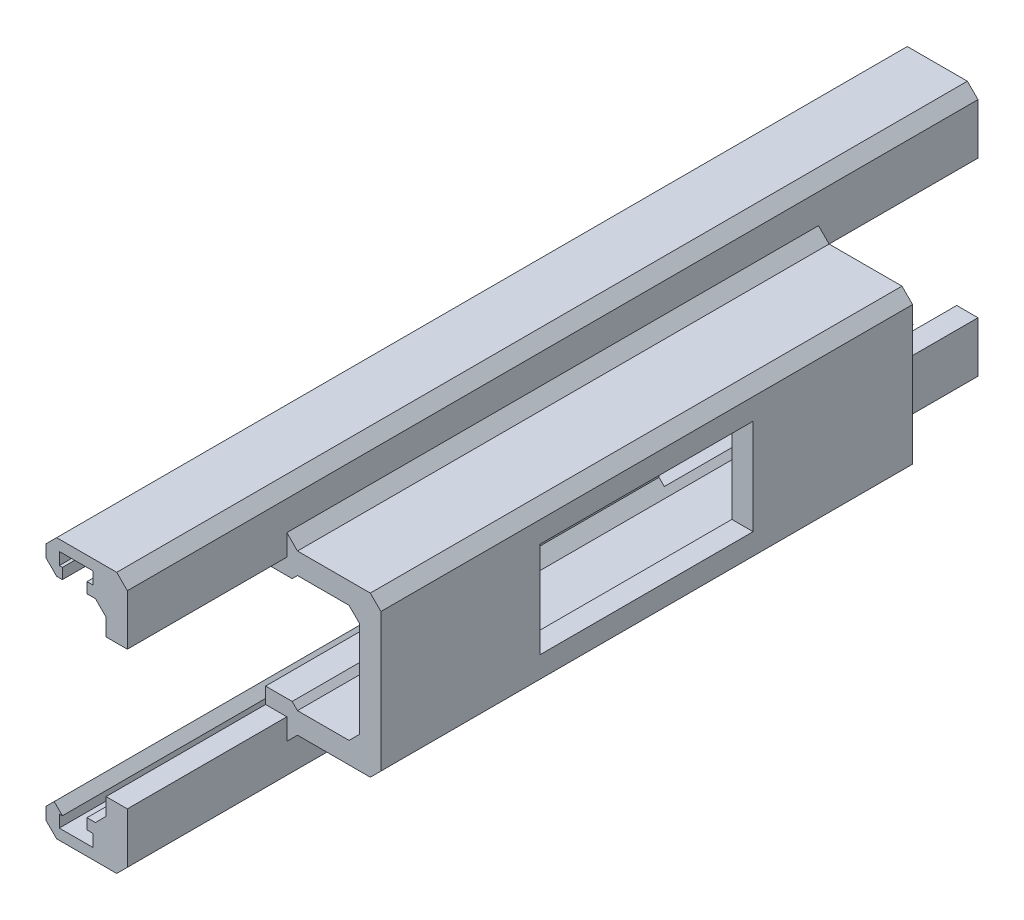
from build123d import *

# Parameters (mm, degrees)
BOSS_EXTRU_1_DEPTH      = 80
BOSS_EXTRU_1_DEPTH_BACK = 80
ESQUISSE4_R             = 1.5
ESQUISSE4_W             = 23
ESQUISSE4_H             = 12.2
ENL_V_MAT_EXTRU_1_DEPTH = 95
ENL_V_START             = -2
ESQUISSE5_W             = 5
ESQUISSE5_H             = 12.2
ESQUISSE5_R             = 1.5
ENL_V_MAT_EXTRU_2_DEPTH = 2
BOSS_EXTRU_3_DEPTH      = 50
BOSS_EXTRU_3_DEPTH_BACK = 50
CHANFREIN2_SIZE         = 2
ESQUISSE11_W            = 30
ESQUISSE11_H            = 20
ENL_V_MAT_EXTRU_4_DEPTH = 11
ENL_V_MAT_EXTRU_5_DEPTH = 8


with BuildPart() as part:
    # Esquisse1 → Boss.-Extru.1 (new, two sides: drawn at the far end of the back side and taken through both)
    with BuildSketch(Plane.XY.offset(-BOSS_EXTRU_1_DEPTH_BACK)):
        Polygon((-2.561538462, -0.921153846), (-2.561538462, 1.078846154), (-5.65, 1.078846154), (-5.65, -5.221153846), (5.65, -5.221153846), (9.45, -5.221153846), (9.65, -5.221153846), (9.65, 43.838846154), (9.45, 43.838846154), (5.65, 43.838846154), (-5.65, 43.838846154), (-5.65, 37.538846154), (-2.561538462, 37.538846154), (-2.561538462, 39.538846154), (-3.15, 39.538846154), (-3.15, 41.838846154), (3.15, 41.838846154), (3.15, 39.538846154), (2.061538462, 39.538846154), (2.061538462, 37.538846154), (5.65, 37.538846154), (5.65, 1.078846154), (2.061538462, 1.078846154), (2.061538462, -0.921153846), (3.15, -0.921153846), (3.15, -3.221153846), (-3.15, -3.221153846), (-3.15, -0.921153846), align=None)
    extrude(amount=BOSS_EXTRU_1_DEPTH + BOSS_EXTRU_1_DEPTH_BACK)

    # Esquisse4 → Enlèv. mat.-Extru.1 (cut)
    with BuildSketch(Plane.ZY.offset(-5.65)):
        with Locations((-14, 19.308846154)):
            Circle(ESQUISSE4_R)
        with Locations(Location((14, 19.308846154, 0), (0, 0, 270))):
            Circle(ESQUISSE4_R)
        with Locations((0, 19.308846154)):
            Rectangle(ESQUISSE4_W, ESQUISSE4_H)
    extrude(amount=-ENL_V_MAT_EXTRU_1_DEPTH, mode=Mode.SUBTRACT)

    # Esquisse5 → Enlèv. mat.-Extru.2 (cut)
    # profile 1 of 2: a face of its own
    with BuildSketch(Plane(origin=(9.65, 0, 0), x_dir=(0, 0, -1), z_dir=(1, 0, 0)).offset(ENL_V_START)):
        with Locations((14, 19.308846154)):
            Rectangle(ESQUISSE5_W, ESQUISSE5_H)
        with Locations(Location((14, 19.308846154, 0), (0, 0, 180))):
            Circle(ESQUISSE5_R, mode=Mode.SUBTRACT)
    # profile 2 of 2: a face of its own
    with BuildSketch(Plane(origin=(9.65, 0, 0), x_dir=(0, 0, -1), z_dir=(1, 0, 0)).offset(ENL_V_START)):
        with Locations((-14, 19.308846154)):
            Rectangle(ESQUISSE5_W, ESQUISSE5_H)
        with Locations(Location((-14, 19.308846154, 0), (0, 0, 90))):
            Circle(ESQUISSE5_R, mode=Mode.SUBTRACT)
    extrude(amount=ENL_V_MAT_EXTRU_2_DEPTH, mode=Mode.SUBTRACT)

    # Esquisse9 → Boss.-Extru.3 (add, two sides: drawn at the far end of the back side and taken through both)
    with BuildSketch(Plane.XY.offset(-BOSS_EXTRU_3_DEPTH_BACK)):
        Polygon((23.35, 4.308846154), (27.35, 4.308846154), (27.35, 8.308846154), (27.35, 30.308846154), (27.35, 34.308846154), (9.65, 34.308846154), (9.65, 30.308846154), (23.35, 30.308846154), (23.35, 8.308846154), (9.65, 8.308846154), (9.65, 4.308846154), align=None)
    extrude(amount=BOSS_EXTRU_3_DEPTH + BOSS_EXTRU_3_DEPTH_BACK)

    # Chanfrein2
    # the kernel refuses this chamfer: 2 mm, written as the material it adds along each edge
    with BuildSketch(Plane(origin=(23.35, 8.308846154, 50), x_dir=(-0.9996219169112968, -0.027495876610587375, 0), z_dir=(0, 0, -1)), Plane(origin=(9.65, 4.308846154, -50), x_dir=(-0.027495876610585623, -0.9996219169112968, 0), z_dir=(0, 0, 1))) as chanfrein2_piece_1:
        Polygon((CHANFREIN2_SIZE * 0.999621916911, CHANFREIN2_SIZE * 0.0274958766106), (-CHANFREIN2_SIZE * 0.0274958766106, CHANFREIN2_SIZE * 0.999621916911), (0, 0), align=None)
    extrude(amount=100)
    with BuildSketch(Plane(origin=(23.35, 30.308846154, 50), x_dir=(-0.9996219169112968, 0.027495876610585647, 0), z_dir=(0, 0, -1)), Plane(origin=(9.65, 30.308846154, 50), x_dir=(-0.027495876610588235, -0.9996219169112968, 0), z_dir=(0, 0, -1)), Plane(origin=(9.65, 34.308846154, -50), x_dir=(-0.02749587661058651, 0.9996219169112968, 0), z_dir=(0, 0, 1)), Plane(origin=(9.65, 8.308846154, -50), x_dir=(-0.02749587661058651, 0.9996219169112968, 0), z_dir=(0, 0, 1))) as chanfrein2_piece_2:
        Polygon((CHANFREIN2_SIZE * 0.999621916911, -CHANFREIN2_SIZE * 0.0274958766106), (-CHANFREIN2_SIZE * 0.0274958766106, -CHANFREIN2_SIZE * 0.999621916911), (0, 0), align=None)
    extrude(amount=100)
    with BuildSketch(Plane(origin=(5.65, 37.538846154, -80), x_dir=(-0.9996219169112968, 0.02749587661058563, 0), z_dir=(0, 0, 1)), Plane(origin=(5.65, 1.078846154, -80), x_dir=(0.027495876610586504, 0.9996219169112968, 0), z_dir=(0, 0, 1))) as chanfrein2_piece_3:
        Polygon((CHANFREIN2_SIZE * 0.999621916911, CHANFREIN2_SIZE * 0.0274958766106), (-CHANFREIN2_SIZE * 0.0274958766106, CHANFREIN2_SIZE * 0.999621916911), (0, 0), align=None)
    extrude(amount=160)
    # the kernel refuses this chamfer: 2 mm, written as the material it takes off along each edge
    with BuildSketch(Plane(origin=(-2.561538462, 1.078846154, -85.143365976), x_dir=(-0.9996219169112968, 0.027495876610586716, 0), z_dir=(0, 0, 1)), Plane(origin=(-5.65, 1.078846154, -85.143365976), x_dir=(-0.027495876610586487, -0.9996219169112968, 0), z_dir=(0, 0, 1)), Plane(origin=(-5.65, -5.221153846, -85.143365976), x_dir=(0.9996219169112968, -0.027495876610586494, 0), z_dir=(0, 0, 1)), Plane(origin=(9.65, -5.221153846, -85.143365976), x_dir=(0.027495876610586494, 0.9996219169112968, 0), z_dir=(0, 0, 1)), Plane(origin=(9.65, 43.838846154, -85.143365976), x_dir=(-0.9996219169112968, 0.027495876610585623, 0), z_dir=(0, 0, 1)), Plane(origin=(-5.65, 37.538846154, -85.143365976), x_dir=(0.999621916911297, -0.027495876610582174, 0), z_dir=(0, 0, 1)), Plane(origin=(-5.65, 43.838846154, -85.143365976), x_dir=(-0.02749587661058651, -0.9996219169112968, 0), z_dir=(0, 0, 1))) as chanfrein2_2_piece_1:
        Polygon((CHANFREIN2_SIZE * 0.999621916911, CHANFREIN2_SIZE * 0.0274958766106), (-CHANFREIN2_SIZE * 0.0274958766106, CHANFREIN2_SIZE * 0.999621916911), (0, 0), align=None)
    extrude(amount=170.286731952, mode=Mode.SUBTRACT)
    with BuildSketch(Plane(origin=(27.35, 4.308846154, -55.143365976), x_dir=(0.027495876610585623, 0.9996219169112968, 0), z_dir=(0, 0, 1)), Plane(origin=(27.35, 34.308846154, -55.143365976), x_dir=(-0.9996219169112968, 0.027495876610585647, 0), z_dir=(0, 0, 1))) as chanfrein2_2_piece_2:
        Polygon((CHANFREIN2_SIZE * 0.999621916911, CHANFREIN2_SIZE * 0.0274958766106), (-CHANFREIN2_SIZE * 0.0274958766106, CHANFREIN2_SIZE * 0.999621916911), (0, 0), align=None)
    extrude(amount=110.286731952, mode=Mode.SUBTRACT)

    # Esquisse11 → Enlèv. mat.-Extru.4 (cut)
    with BuildSketch(Plane.ZY.offset(-5.65)):
        Polygon((-50, 29.308846154), (-50, 32.308846154), (-80, 32.308846154), (-80, 6.308846154), (-50, 6.308846154), (-50, 9.308846154), align=None)
        Polygon((80, 32.308846154), (50, 32.308846154), (50, 29.308846154), (50, 9.308846154), (50, 6.308846154), (80, 6.308846154), align=None)
        with Locations((-35, 19.308846154)):
            Rectangle(ESQUISSE11_W, ESQUISSE11_H)
        with Locations((35, 19.308846154)):
            Rectangle(ESQUISSE11_W, ESQUISSE11_H)
    extrude(amount=-ENL_V_MAT_EXTRU_4_DEPTH, mode=Mode.SUBTRACT)

    # Esquisse12 → Enlèv. mat.-Extru.5 (cut)
    with BuildSketch(Plane(origin=(27.35, 0, 0), x_dir=(0, 0, -1), z_dir=(1, 0, 0))):
        Polygon((20, 28.308846154), (10, 28.308846154), (-10, 28.308846154), (-20.122761397, 28.308846154), (-20.122761397, 10.308846154), (-10, 10.308846154), (10, 10.308846154), (20, 10.308846154), align=None)
    extrude(amount=-ENL_V_MAT_EXTRU_5_DEPTH, mode=Mode.SUBTRACT)


solid = part.part
